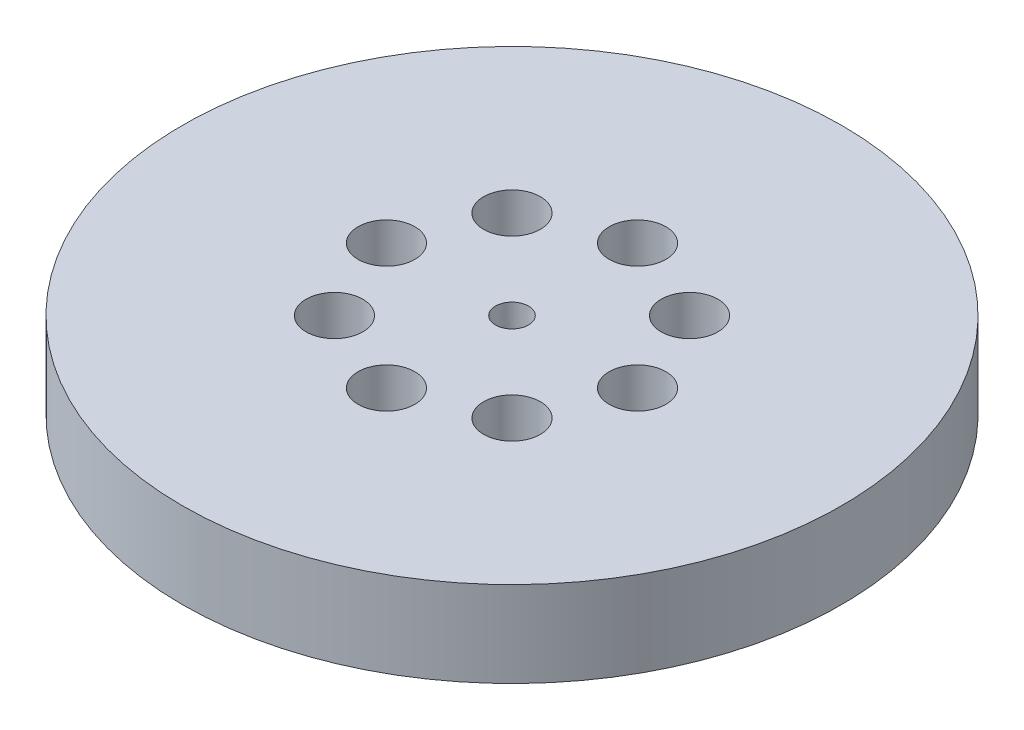
from build123d import *

# Parameters (mm, degrees)
SKETCH1_R           = 100
BOSS_EXTRUDE1_DEPTH = 26
SKETCH2_R           = 5
CUT_EXTRUDE1_DEPTH  = 144.791515744
SKETCH3_R           = 8.605731223
CUT_EXTRUDE2_DEPTH  = 20.949750138
CIRPATTERN1_COUNT   = 8


with BuildPart() as part:
    # Sketch1 → Boss-Extrude1 (new body)
    with BuildSketch(Plane(origin=(0, 0, 0), x_dir=(1, 0, 0), z_dir=(0, 1, 0))):
        Circle(SKETCH1_R)
    extrude(amount=BOSS_EXTRUDE1_DEPTH)

    # Sketch2 → Cut-Extrude1 (cut, through all)
    with BuildSketch(Plane(origin=(0, 0, 0), x_dir=(1, 0, 0), z_dir=(0, 1, 0))):
        Circle(SKETCH2_R)
    extrude(amount=CUT_EXTRUDE1_DEPTH, mode=Mode.SUBTRACT)

    # Sketch3 → Cut-Extrude2 (cut)
    with BuildSketch(Plane(origin=(0, 26, 0), x_dir=(1, 0, 0), z_dir=(0, 1, 0))):
        with Locations((-38.094803889, 0)):
            Circle(SKETCH3_R)
    cut_extrude2 = extrude(amount=-CUT_EXTRUDE2_DEPTH, mode=Mode.SUBTRACT)

    # CirPattern1: Cut-Extrude2 ×8 about axis
    cirpattern1_axis = Axis((0, 0, 0), (0, 1, 0))
    for i in range(1, CIRPATTERN1_COUNT):
        add(cut_extrude2.rotate(cirpattern1_axis, i * 360 / CIRPATTERN1_COUNT), mode=Mode.SUBTRACT)


solid = part.part
